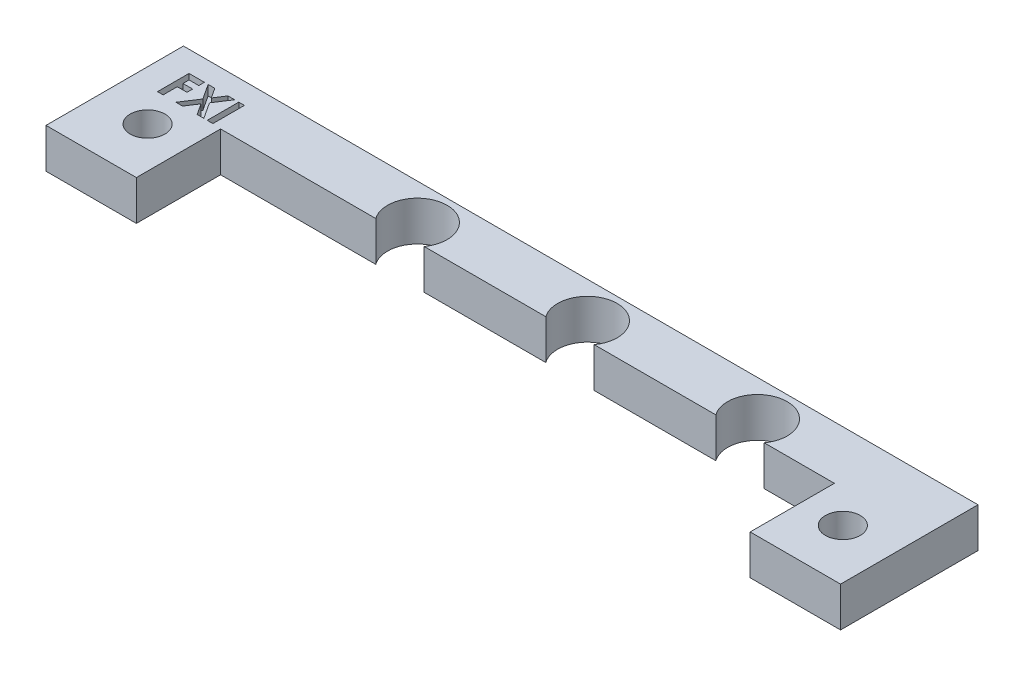
from build123d import *

# Parameters (mm, degrees)
BOSS_EXTRUDE1_OUTLINE_R = 1.75
BOSS_EXTRUDE1_DEPTH     = 4
SKETCH2_W               = 0.569871795
SKETCH2_H               = 3.175
CUT_EXTRUDE1_DEPTH      = 1


# Read off the part's stored shape, not the designer's step: Boss-Extrude1
with BuildPart() as part:
    # Boss-Extrude1 outline → Boss-Extrude1 (new body)
    with BuildSketch(Plane(origin=(0, 0, 0), x_dir=(1, 0, 0), z_dir=(0, 1, 0))):
        with BuildLine():
            Line((25.296474615, -10.33744254), (37.54307775, -10.33744254))
            ThreePointArc((37.54307775, -10.33744254), (39.979776182, -5.587442326), (42.416474615, -10.33744254))
            Line((42.416474615, -10.33744254), (49.479776182, -10.33744254))
            Line((49.479776182, -10.33744254), (49.479776182, -18.81631662))
            Line((49.479776182, -18.81631662), (58.579776182, -18.81631662))
            Line((58.579776182, -18.81631662), (58.579776182, -4.977921711))
            Line((58.579776182, -4.977921711), (-21.420223818, -4.977921711))
            Line((-21.420223818, -4.977921711), (-21.420223818, -18.81631662))
            Line((-21.420223818, -18.81631662), (-12.320223818, -18.81631662))
            Line((-12.320223818, -18.81631662), (-12.320223818, -10.33744254))
            Line((-12.320223818, -10.33744254), (3.30307775, -10.33744254))
            ThreePointArc((3.30307775, -10.33744254), (5.739776182, -5.587442326), (8.176474615, -10.33744254))
            Line((8.176474615, -10.33744254), (20.42307775, -10.33744254))
            ThreePointArc((20.42307775, -10.33744254), (22.859776182, -5.587442326), (25.296474615, -10.33744254))
        make_face()
        with Locations((-16.420223818, -13.587442433)):
            Circle(BOSS_EXTRUDE1_OUTLINE_R, mode=Mode.SUBTRACT)
        with Locations((53.579776182, -13.587442433)):
            Circle(BOSS_EXTRUDE1_OUTLINE_R, mode=Mode.SUBTRACT)
    extrude(amount=BOSS_EXTRUDE1_DEPTH)

    # Sketch2 → Cut-Extrude1 (cut)
    with BuildSketch(Plane(origin=(0, 4, 0), x_dir=(1, 0, 0), z_dir=(0, 1, 0))):
        Polygon((-18.749121586, -7.085274104), (-17.202326714, -7.085274104), (-17.202326714, -7.655145899), (-18.179249791, -7.655145899), (-18.179249791, -8.265722822), (-17.202326714, -8.265722822), (-17.202326714, -8.835594617), (-18.179249791, -8.835594617), (-18.179249791, -10.260274104), (-18.749121586, -10.260274104), align=None)
        Polygon((-16.826440296, -7.085274104), (-16.15480568, -7.085274104), (-15.491439294, -8.104810362), (-14.826800873, -7.085274104), (-14.153258204, -7.085274104), (-15.154985969, -8.621256676), (-14.088384406, -10.260274104), (-14.760019022, -10.260274104), (-15.491439294, -9.136430955), (-16.224131602, -10.260274104), (-16.897038253, -10.260274104), (-15.827256602, -8.619984641), align=None)
        with Locations((-13.45745492, -8.672774104)):
            Rectangle(SKETCH2_W, SKETCH2_H)
    extrude(amount=-CUT_EXTRUDE1_DEPTH, mode=Mode.SUBTRACT)


solid = part.part
